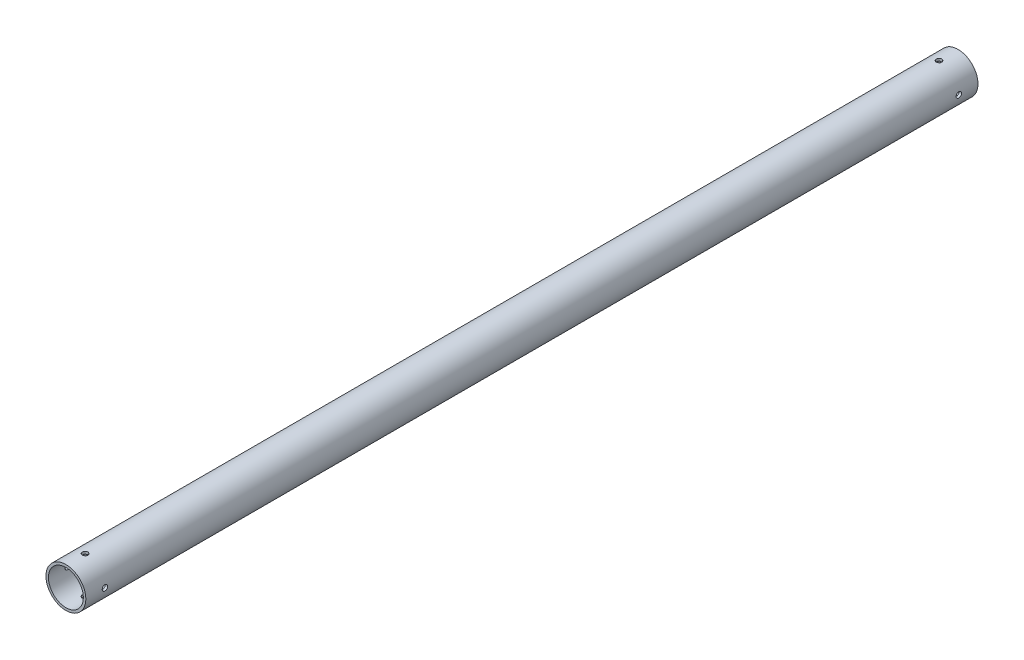
from build123d import *

# Parameters (mm, degrees)
SKETCH2_R               = 12.7
SKETCH2_R_2             = 11.1125
BOSS_EXTRUDE1_DEPTH     = 284.23690041
CUT_EXTRUDE1_DEPTH      = 285.803784305
CUT_EXTRUDE1_DEPTH_BACK = 285.803784305
SKETCH3_R               = 1.7526
CUT_EXTRUDE2_DEPTH      = 285.803784415
CUT_EXTRUDE2_DEPTH_BACK = 285.803784415
SKETCH4_R               = 1.7526


with BuildPart() as part:
    # Sketch2 → Boss-Extrude1 (new, symmetric)
    with BuildSketch(Plane.XY):
        Circle(SKETCH2_R)
        Circle(SKETCH2_R_2, mode=Mode.SUBTRACT)
    extrude(amount=BOSS_EXTRUDE1_DEPTH, both=True)

    # Sketch3 → Cut-Extrude1 (cut, two sides: drawn at the far end of the back side and taken through both)
    with BuildSketch(Plane(origin=(0, 0, 0), x_dir=(1, 0, 0), z_dir=(0, 1, 0)).offset(-CUT_EXTRUDE1_DEPTH_BACK)):
        with Locations((0, -272.04490041)):
            Circle(SKETCH3_R)
        with Locations((0, 272.04490041)):
            Circle(SKETCH3_R)
    extrude(amount=CUT_EXTRUDE1_DEPTH + CUT_EXTRUDE1_DEPTH_BACK, mode=Mode.SUBTRACT)

    # Sketch4 → Cut-Extrude2 (cut, two sides: drawn at the far end of the back side and taken through both)
    with BuildSketch(Plane(origin=(0, 0, 0), x_dir=(0, 0, -1), z_dir=(1, 0, 0)).offset(-CUT_EXTRUDE2_DEPTH_BACK)):
        with Locations((-272.04490041, 0)):
            Circle(SKETCH4_R)
        with Locations((272.04490041, 0)):
            Circle(SKETCH4_R)
    extrude(amount=CUT_EXTRUDE2_DEPTH + CUT_EXTRUDE2_DEPTH_BACK, mode=Mode.SUBTRACT)


solid = part.part
